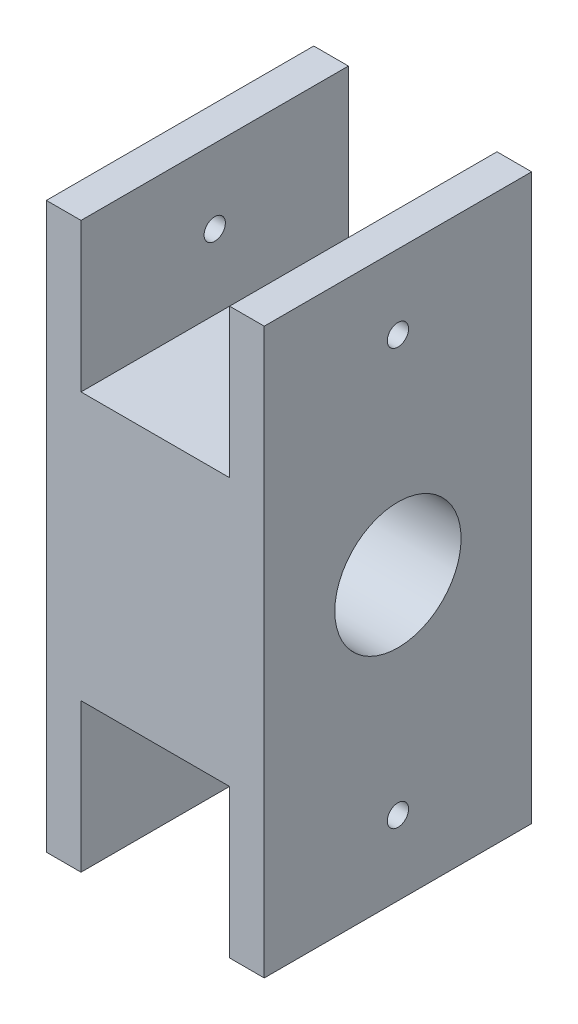
from build123d import *

# Parameters (mm, degrees)
BOSS_EXTRUDE1_DEPTH = 53.99999995
HOLE1_D             = 4.300000036
HOLE2_D             = 25.500000054
HOLE2_CBORE_D       = 40.00000001
HOLE2_CBORE_DEPTH   = 11.999999876


with BuildPart() as part:
    # Sketch1 → Boss-Extrude1 (new body)
    with BuildSketch(Plane.XY):
        Polygon((-21.999999942, 56.999999919), (-14.999999972, 56.999999919), (-14.999999972, 26.999999975), (14.999999972, 26.999999975), (14.999999972, 56.999999919), (21.999999942, 56.999999919), (21.999999942, -56.999999919), (14.999999972, -56.999999919), (14.999999972, -26.999999975), (-14.999999972, -26.999999975), (-14.999999972, -56.999999919), (-21.999999942, -56.999999919), align=None)
    extrude(amount=BOSS_EXTRUDE1_DEPTH)

    # Hole1 (through all)
    with Locations(Plane.ZY.offset(21.999999942)):
        with Locations((26.999999975, 41.999999947), (26.999999975, -41.999999947)):
            Hole(HOLE1_D / 2)

    # Hole2 (through all)
    with Locations(Plane.ZY.offset(21.999999942)):
        with Locations((26.999999975, 0)):
            CounterBoreHole(HOLE2_D / 2, HOLE2_CBORE_D / 2, HOLE2_CBORE_DEPTH)


solid = part.part
